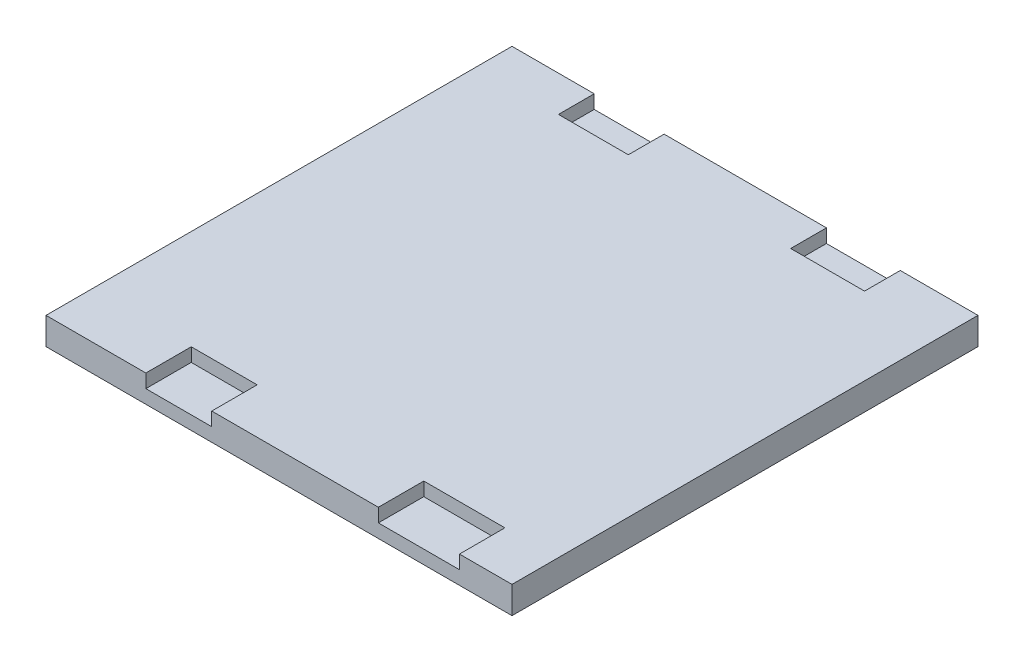
from build123d import *

# Parameters (mm, degrees)
SKETCH1_W           = 139.7
SKETCH1_H           = 139.7
BOSS_EXTRUDE1_DEPTH = 4.064
BOSS_EXTRUDE2_DEPTH = 4.064


with BuildPart() as part:
    # Sketch1 → Boss-Extrude1 (new body)
    with BuildSketch(Plane(origin=(0, 0, 0), x_dir=(1, 0, 0), z_dir=(0, 1, 0))):
        Rectangle(SKETCH1_W, SKETCH1_H)
    extrude(amount=BOSS_EXTRUDE1_DEPTH)

    # Sketch2 → Boss-Extrude2 (add)
    with BuildSketch(Plane(origin=(0, 4.064, 0), x_dir=(1, 0, 0), z_dir=(0, 1, 0))):
        Polygon((24.414352355, 69.85), (-24.254568358, 69.85), (-24.254568358, 59.130264986), (-45.201022113, 59.130264986), (-45.201022113, 69.85), (-69.85, 69.85), (-69.85, -69.85), (-39.917011793, -69.85), (-39.917011793, -56.23621007), (-20.160619296, -56.23621007), (-20.160619296, -69.85), (29.788942651, -69.85), (29.788942651, -56.23621007), (54.101266624, -56.23621007), (54.101266624, -69.85), (69.85, -69.85), (69.85, 69.85), (46.550867368, 69.85), (46.550867368, 59.130264986), (24.414352355, 59.130264986), align=None)
    extrude(amount=BOSS_EXTRUDE2_DEPTH)


solid = part.part
